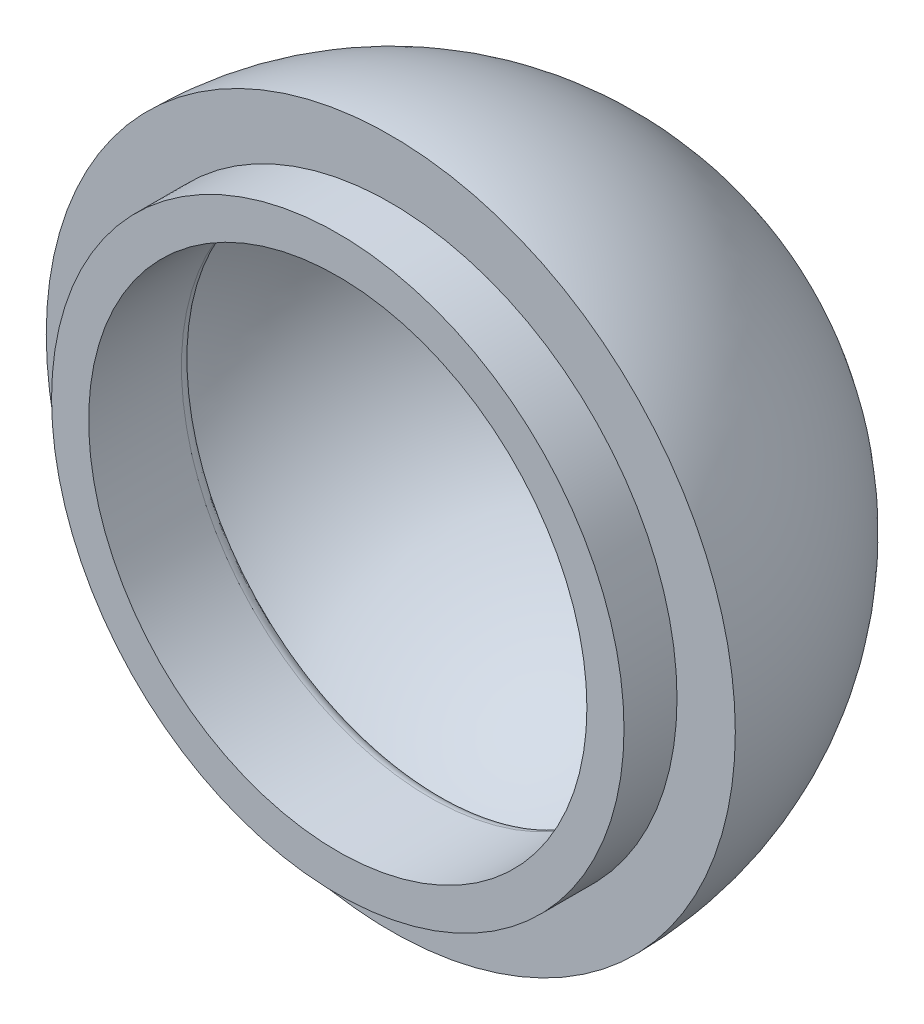
from build123d import *

# Parameters (mm, degrees)
REVOLVE1_ANGLE      = 180
SKETCH2_R           = 11
SKETCH2_R_2         = 10.8
BOSS_EXTRUDE1_DEPTH = 5
SKETCH3_R           = 10.8
SKETCH3_R_2         = 9.4
BOSS_EXTRUDE2_DEPTH = 2
FILLET2_R           = 0.5


with BuildPart() as part:
    # Sketch1 → Revolve1 (revolve)
    with BuildSketch(Plane.XY):
        with BuildLine():
            Line((0, 13), (0, 11))
            ThreePointArc((0, 11), (-11, 0), (0, -11))
            Line((0, -11), (0, -13))
            ThreePointArc((0, -13), (-13, 0), (0, 13))
        make_face()
    revolve(axis=Axis((0, 22.422680412, 0), (0, -1, 0)), revolution_arc=REVOLVE1_ANGLE)

    # Sketch2 → Boss-Extrude1 (add)
    with BuildSketch(Plane.XY):
        Circle(SKETCH2_R)
        Circle(SKETCH2_R_2, mode=Mode.SUBTRACT)
    extrude(amount=-BOSS_EXTRUDE1_DEPTH)

    # Sketch3 → Boss-Extrude2 (add, symmetric)
    with BuildSketch(Plane.XY):
        Circle(SKETCH3_R)
        Circle(SKETCH3_R_2, mode=Mode.SUBTRACT)
    extrude(amount=BOSS_EXTRUDE2_DEPTH, both=True)

    # Fillet2
    fillet2_edges = [part.edges().sort_by_distance(p)[0] for p in [
        (-9.4, 0, -2),
    ]]
    fillet(fillet2_edges, radius=FILLET2_R)


solid = part.part
